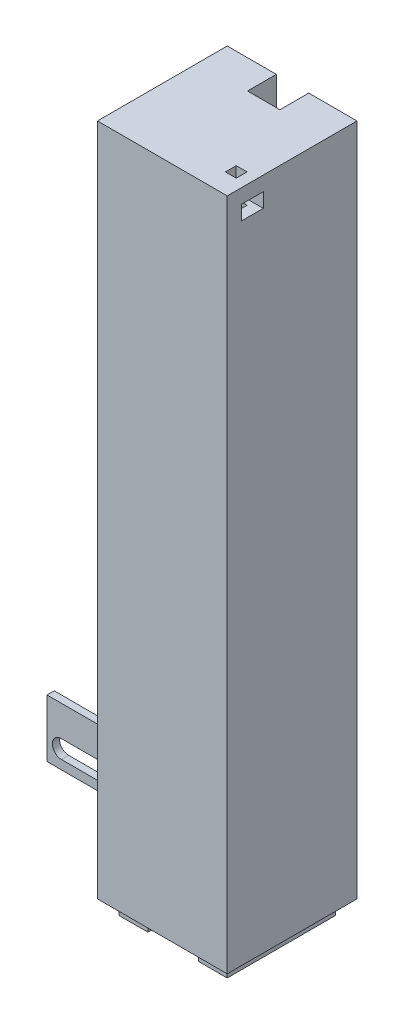
from build123d import *

# Parameters (mm, degrees)
SKETCH1_W           = 36
SKETCH1_H           = 36
BOSS_EXTRUDE1_DEPTH = 186.9
BOSS_EXTRUDE2_DEPTH = 4
SKETCH3_R           = 2
CUT_EXTRUDE1_DEPTH  = 5
SKETCH4_W           = 9
SKETCH4_H           = 186.9
CUT_EXTRUDE2_DEPTH  = 8
SKETCH5_W           = 6
SKETCH5_H           = 4
CUT_EXTRUDE3_DEPTH  = 9
SKETCH6_W           = 3
SKETCH6_H           = 3
CUT_EXTRUDE4_DEPTH  = 10
SKETCH7_W           = 2
SKETCH7_H           = 16
BOSS_EXTRUDE3_DEPTH = 40
CUT_EXTRUDE5_REACH  = 194.893


with BuildPart() as part:
    # Sketch1 → Boss-Extrude1 (new body)
    with BuildSketch(Plane(origin=(0, 0, 0), x_dir=(1, 0, 0), z_dir=(0, 1, 0))):
        with Locations((18, 18)):
            Rectangle(SKETCH1_W, SKETCH1_H)
    extrude(amount=BOSS_EXTRUDE1_DEPTH)

    # Sketch2 → Boss-Extrude2 (add)
    with BuildSketch(Plane.XZ):
        Polygon((3, -3), (7, -3), (11, -3), (11, -11), (7, -11), (7, -25), (11, -25), (11, -33), (7, -33), (3, -33), align=None)
        Polygon((29, -3), (33, -3), (33, -33), (29, -33), (25, -33), (25, -25), (29, -25), (29, -11), (25, -11), (25, -3), align=None)
    extrude(amount=BOSS_EXTRUDE2_DEPTH)

    # Sketch3 → Cut-Extrude1 (cut)
    with BuildSketch(Plane.XZ):
        with Locations((18, -18)):
            Circle(SKETCH3_R)
    extrude(amount=-CUT_EXTRUDE1_DEPTH, mode=Mode.SUBTRACT)

    # Sketch4 → Cut-Extrude2 (cut)
    with BuildSketch(Plane.XY.offset(-36)):
        with Locations((18.12, 93.45)):
            Rectangle(SKETCH4_W, SKETCH4_H)
    extrude(amount=CUT_EXTRUDE2_DEPTH, mode=Mode.SUBTRACT)

    # Sketch5 → Cut-Extrude3 (cut)
    with BuildSketch(Plane(origin=(36, 0, 0), x_dir=(0, 0, -1), z_dir=(1, 0, 0))):
        with Locations((7, 180.9)):
            Rectangle(SKETCH5_W, SKETCH5_H)
    extrude(amount=-CUT_EXTRUDE3_DEPTH, mode=Mode.SUBTRACT)

    # Sketch6 → Cut-Extrude4 (cut)
    with BuildSketch(Plane(origin=(0, 186.9, 0), x_dir=(1, 0, 0), z_dir=(0, 1, 0))):
        with Locations((31.5, 7)):
            Rectangle(SKETCH6_W, SKETCH6_H)
    extrude(amount=-CUT_EXTRUDE4_DEPTH, mode=Mode.SUBTRACT)

    # Sketch7 → Boss-Extrude3 (add)
    with BuildSketch(Plane.ZY):
        with Locations((-27, 8)):
            Rectangle(SKETCH7_W, SKETCH7_H)
    extrude(amount=BOSS_EXTRUDE3_DEPTH)

    # Sketch8 → Cut-Extrude5 (cut, up to next)
    with BuildSketch(Plane.XY.offset(-26), mode=Mode.PRIVATE) as cut_extrude5_sk1:
        with BuildLine():
            Line((-36, 7.5), (-12, 7.5))
            ThreePointArc((-12, 7.5), (-9.5, 5), (-12, 2.5))
            Line((-12, 2.5), (-36, 2.5))
            ThreePointArc((-36, 2.5), (-38.5, 5), (-36, 7.5))
        make_face()
    cut_extrude5_tool1 = extrude(cut_extrude5_sk1.sketch, amount=-CUT_EXTRUDE5_REACH, mode=Mode.PRIVATE) & part.part
    add(cut_extrude5_tool1.solids().sort_by_distance((-24, 5, -26))[0], mode=Mode.SUBTRACT)


solid = part.part
